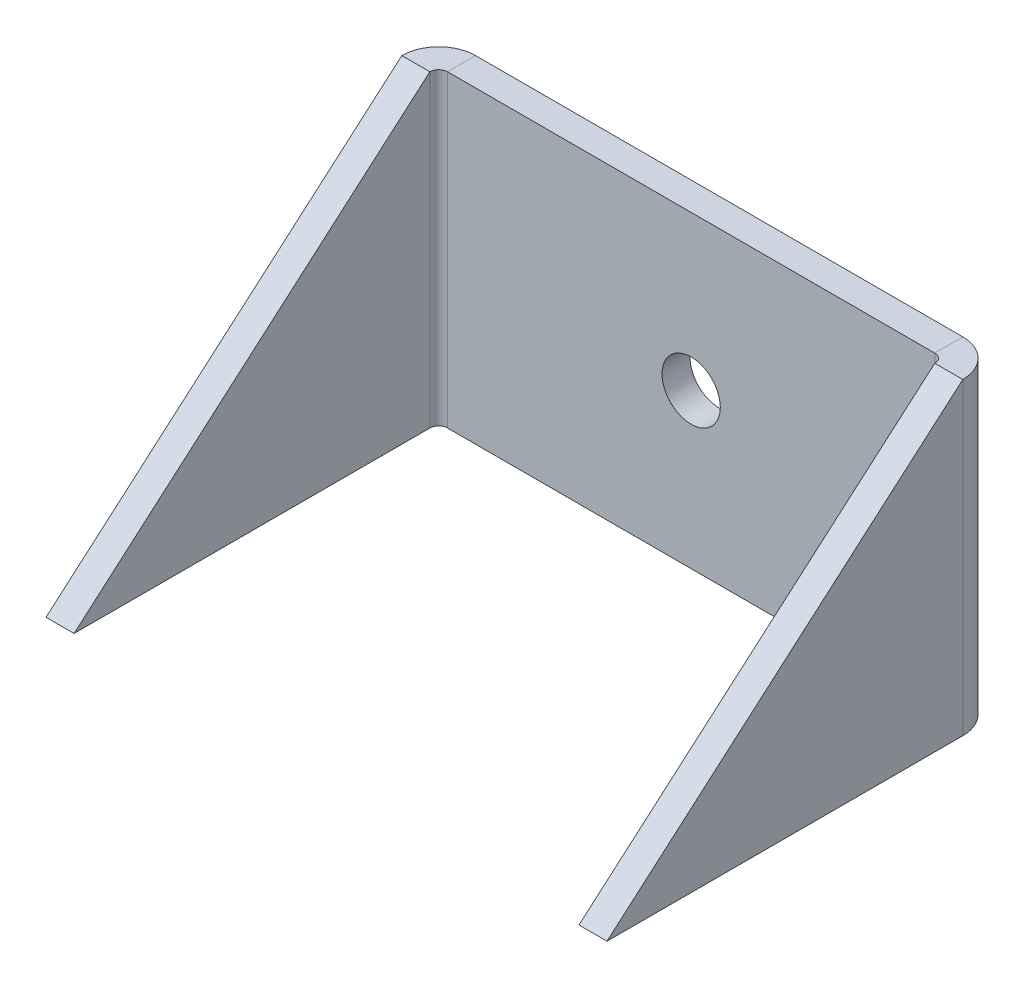
from build123d import *

# Parameters (mm, degrees)
SKETCH2_W                    = 57.15
SKETCH2_H                    = 34.925
BASE_FLANGE1_DEPTH           = 3.175
EDGE_FLANGE1_STRIP_W         = 14.7
EDGE_FLANGE1_STRIP_H         = 3.175
EDGE_FLANGE1_STRIP_CUT_DEPTH = 34.925
EDGE_FLANGE1_DEPTH           = 34.925
CUT_EXTRUDE1_DEPTH           = 3.175
M6_CLEARANCE_HOLE1_D         = 6.6


# Sheet-metal steps are written as plain solids
with BuildPart() as part:
    # Sketch2 → Base-Flange1 (new body)
    with BuildSketch(Plane.XY):
        Rectangle(SKETCH2_W, SKETCH2_H)
    extrude(amount=BASE_FLANGE1_DEPTH)

    # Edge-Flange1 strip (across the edge) → Edge-Flange1 strip cut (cut)
    with BuildSketch(Plane(origin=(28.575, -17.4625, 3.175), x_dir=(-1, 0, 0), z_dir=(0, 1, 0))):
        with Locations((-6.35, -1.5875)):
            Rectangle(EDGE_FLANGE1_STRIP_W, EDGE_FLANGE1_STRIP_H)
    edge_flange1_strip_cut = extrude(amount=EDGE_FLANGE1_STRIP_CUT_DEPTH, mode=Mode.SUBTRACT)

    # Edge-Flange1 section (across the edge) → Edge-Flange1 (add)
    with BuildSketch(Plane(origin=(28.575, -17.4625, 3.175), x_dir=(-1, 0, 0), z_dir=(0, 1, 0))):
        with BuildLine():
            Line((-3.175, 1), (-3.175, 41.275))
            Line((-3.175, 41.275), (0, 41.275))
            Line((0, 41.275), (0, 1))
            ThreePointArc((0, 1), (0.292893219, 0.292893219), (1, 0))
            Line((1, 0), (1, -3.175))
            ThreePointArc((1, -3.175), (-1.952170811, -1.952170811), (-3.175, 1))
        make_face()
    edge_flange1 = extrude(amount=EDGE_FLANGE1_DEPTH)

    # Sketch10 → Cut-Extrude1 (cut)
    with BuildSketch(Plane(origin=(31.75, 0, 0), x_dir=(0, 0, -1), z_dir=(1, 0, 0))):
        Polygon((-4.175, 17.4625), (-44.45, -17.4625), (-44.45, 17.4625), align=None)
    cut_extrude1 = extrude(amount=-CUT_EXTRUDE1_DEPTH, mode=Mode.SUBTRACT)

    # Mirror1: Edge-Flange1 strip cut, Edge-Flange1, Cut-Extrude1 across plane
    add(edge_flange1_strip_cut.mirror(Plane(origin=(0, 0, 0), x_dir=(0, 0, 1), z_dir=(1, 0, 0))), mode=Mode.SUBTRACT)
    add(edge_flange1.mirror(Plane(origin=(0, 0, 0), x_dir=(0, 0, 1), z_dir=(1, 0, 0))))
    add(cut_extrude1.mirror(Plane(origin=(0, 0, 0), x_dir=(0, 0, 1), z_dir=(1, 0, 0))), mode=Mode.SUBTRACT)

    # M6 Clearance Hole1 (through all)
    with Locations(Plane.XY.offset(3.175)):
        with Locations((0, 0)):
            Hole(M6_CLEARANCE_HOLE1_D / 2)


solid = part.part
